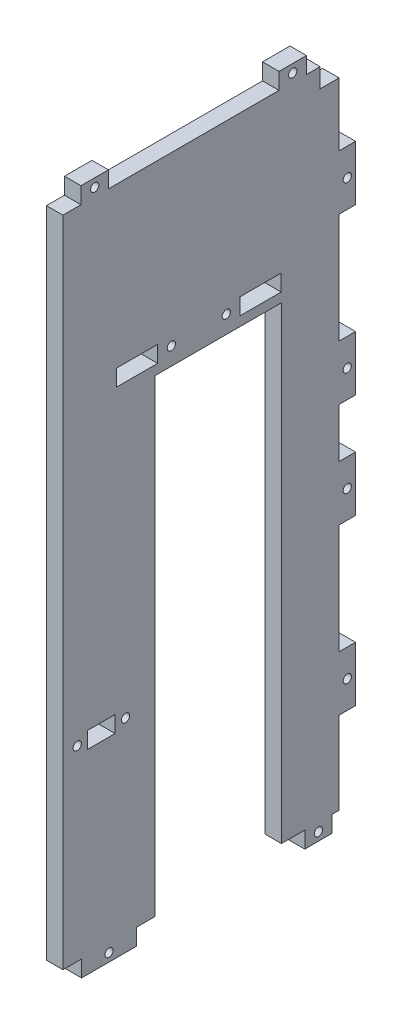
from build123d import *

# Parameters (mm, degrees)
ESQUISSE1_W             = 100.58
ESQUISSE1_H             = 238
ESQUISSE1_W_2           = 10
ESQUISSE1_H_2           = 6
ESQUISSE1_W_3           = 15
BOSS_EXTRU_1_DEPTH      = 6
ESQUISSE3_W             = 20
ESQUISSE3_H             = 6
ESQUISSE3_W_2           = 10
ESQUISSE3_W_3           = 6
ESQUISSE3_H_2           = 20
BOSS_EXTRU_5_DEPTH      = 6
ESQUISSE6_W             = 46
ESQUISSE6_H             = 170.59
ENL_V_MAT_EXTRU_2_DEPTH = 6
ESQUISSE7_W             = 6.88
ESQUISSE7_H             = 7
ENL_V_MAT_EXTRU_3_DEPTH = 6
ESQUISSE8_R             = 1.5
ENL_V_MAT_EXTRU_4_DEPTH = 6


with BuildPart() as part:
    # Esquisse1 → Boss.-Extru.1 (new body)
    with BuildSketch(Plane(origin=(0, 0, 0), x_dir=(0, 0, -1), z_dir=(1, 0, 0))):
        Rectangle(ESQUISSE1_W, ESQUISSE1_H)
        with Locations((-36.29, -51)):
            Rectangle(ESQUISSE1_W_2, ESQUISSE1_H_2, mode=Mode.SUBTRACT)
        with Locations((-23.295, 58)):
            Rectangle(ESQUISSE1_W_3, ESQUISSE1_H_2, mode=Mode.SUBTRACT)
        with Locations((21.705, 58)):
            Rectangle(ESQUISSE1_W_3, ESQUISSE1_H_2, mode=Mode.SUBTRACT)
    extrude(amount=BOSS_EXTRU_1_DEPTH)

    # Esquisse3 → Boss.-Extru.5 (add)
    with BuildSketch(Plane(origin=(6, 0, 0), x_dir=(0, 0, -1), z_dir=(1, 0, 0))):
        with Locations((-33.5, -122)):
            Rectangle(ESQUISSE3_W, ESQUISSE3_H)
        with Locations((42.79, -122)):
            Rectangle(ESQUISSE3_W_2, ESQUISSE3_H)
        with Locations((53.29, 19)):
            Rectangle(ESQUISSE3_W_3, ESQUISSE3_H_2)
        with Locations((53.29, 79)):
            Rectangle(ESQUISSE3_W_3, ESQUISSE3_H_2)
        with Locations((53.29, -79)):
            Rectangle(ESQUISSE3_W_3, ESQUISSE3_H_2)
        with Locations((53.29, -19)):
            Rectangle(ESQUISSE3_W_3, ESQUISSE3_H_2)
        with Locations((33.41, 122)):
            Rectangle(ESQUISSE3_W_2, ESQUISSE3_H)
        with Locations((-38.71, 122)):
            Rectangle(ESQUISSE3_W_2, ESQUISSE3_H)
    extrude(amount=-BOSS_EXTRU_5_DEPTH)

    # Esquisse6 → Enlèv. mat.-Extru.2 (cut)
    with BuildSketch(Plane(origin=(6, 0, 0), x_dir=(0, 0, -1), z_dir=(1, 0, 0))):
        with Locations((6.29, -33.705)):
            Rectangle(ESQUISSE6_W, ESQUISSE6_H)
    extrude(amount=-ENL_V_MAT_EXTRU_2_DEPTH, mode=Mode.SUBTRACT)

    # Esquisse7 → Enlèv. mat.-Extru.3 (cut)
    with BuildSketch(Plane.ZY):
        with Locations((-46.85, 115.5)):
            Rectangle(ESQUISSE7_W, ESQUISSE7_H)
    extrude(amount=-ENL_V_MAT_EXTRU_3_DEPTH, mode=Mode.SUBTRACT)

    # Esquisse8 → Enlèv. mat.-Extru.4 (cut)
    with BuildSketch(Plane.ZY):
        with Locations((-9.205, 58)):
            Circle(ESQUISSE8_R)
        with Locations((10.795, 58)):
            Circle(ESQUISSE8_R)
        with Locations((27.5, -51)):
            Circle(ESQUISSE8_R)
        with Locations((45.08, -51)):
            Circle(ESQUISSE8_R)
        with Locations((38.71, 122)):
            Circle(ESQUISSE8_R)
        with Locations((-33.41, 122)):
            Circle(ESQUISSE8_R)
        with Locations((33.5, -122)):
            Circle(ESQUISSE8_R)
        with Locations((-53.29, 79)):
            Circle(ESQUISSE8_R)
        with Locations((-42.79, -122)):
            Circle(ESQUISSE8_R)
        with Locations((-53.29, 19)):
            Circle(ESQUISSE8_R)
        with Locations((-53.29, -79)):
            Circle(ESQUISSE8_R)
        with Locations((-53.29, -19)):
            Circle(ESQUISSE8_R)
    extrude(amount=-ENL_V_MAT_EXTRU_4_DEPTH, mode=Mode.SUBTRACT)


solid = part.part
